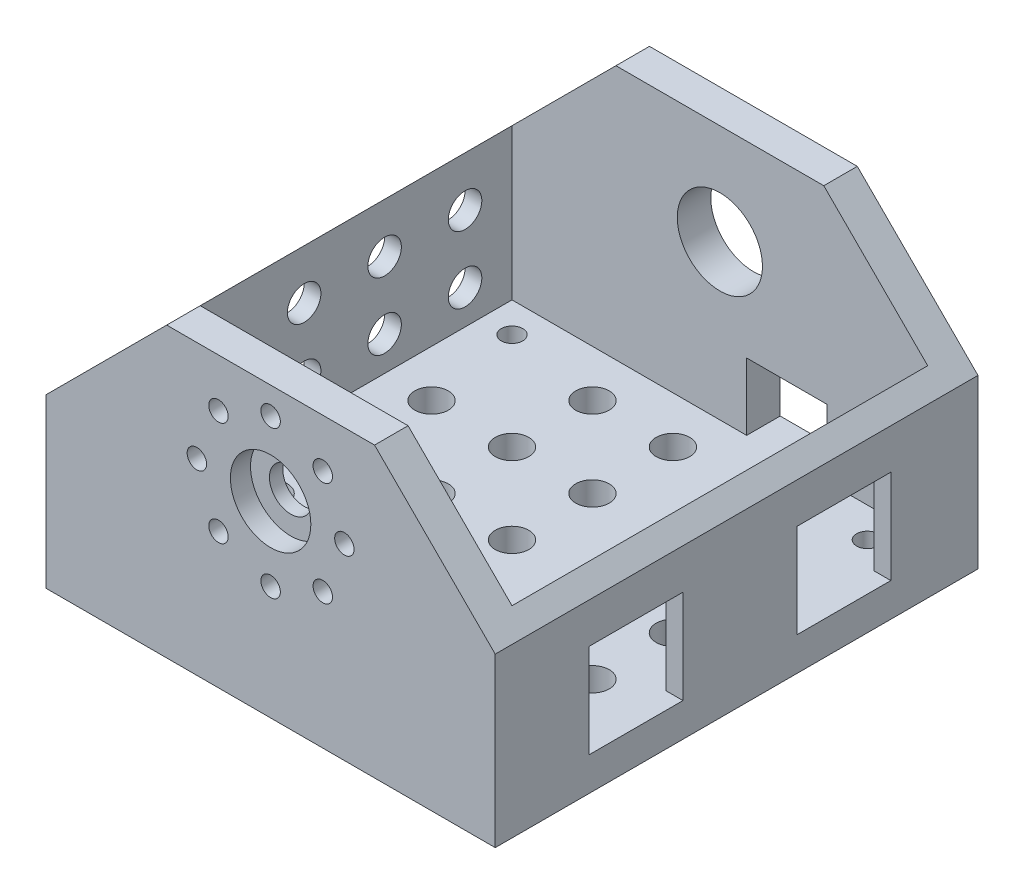
from build123d import *

# Parameters (mm, degrees)
SKETCH1_W             = 67
SKETCH1_H             = 72
BOSS_EXTRUDE1_DEPTH   = 43
CUT_EXTRUDE1_DEPTH    = 91.306422806
SKETCH3_W             = 62
SKETCH3_H             = 62
CUT_EXTRUDE2_DEPTH    = 38
CUT_EXTRUDE3_REACH    = 92.306
SKETCH4_R             = 6.35
SKETCH5_R             = 6
CUT_EXTRUDE4_DEPTH    = 3
CUT_EXTRUDE5_REACH    = 89.933
SKETCH6_R             = 3.175
CUT_EXTRUDE6_REACH    = 92.306
SKETCH7_R             = 1.45
CIRPATTERN1_COUNT     = 8
CUT_EXTRUDE7_REACH    = 89.373
SKETCH8_R             = 2.5
FRONT_VENT_COUNT      = 5
FRONT_VENT_PITCH      = 12
FRONT_VENT_COUNT_DIR2 = 2
FRONT_VENT_PITCH_DIR2 = 10
BOTTOM_VENT_REACH     = 64.147
SKETCH10_R            = 2.5
SKETCH12_R            = 1.6
MOUNTING_HOLES_DEPTH  = 63.147003146
CUT_EXTRUDE12_REACH   = 89.373
SKETCH13_W            = 14
SKETCH13_H            = 14
CUT_EXTRUDE13_REACH   = 92.306
SKETCH14_W            = 12
SKETCH14_H            = 10


with BuildPart() as part:
    # Sketch1 → Boss-Extrude1 (new body)
    with BuildSketch(Plane(origin=(0, 0, 0), x_dir=(1, 0, 0), z_dir=(0, 1, 0))):
        Rectangle(SKETCH1_W, SKETCH1_H)
    extrude(amount=BOSS_EXTRUDE1_DEPTH)

    # Sketch2 → Cut-Extrude1 (cut, through all)
    with BuildSketch(Plane.XY.offset(36)):
        Polygon((-33.5, 43), (-33.5, 25), (-15.5, 43), align=None)
        Polygon((33.5, 43), (33.5, 25), (15.5, 43), align=None)
    extrude(amount=-CUT_EXTRUDE1_DEPTH, mode=Mode.SUBTRACT)

    # Sketch3 → Cut-Extrude2 (cut)
    with BuildSketch(Plane(origin=(0, 43, 0), x_dir=(1, 0, 0), z_dir=(0, 1, 0))):
        Rectangle(SKETCH3_W, SKETCH3_H)
    extrude(amount=-CUT_EXTRUDE2_DEPTH, mode=Mode.SUBTRACT)

    # Sketch4 → Cut-Extrude3 (cut, up to next)
    with BuildSketch(Plane(origin=(0, 0, -36), x_dir=(-1, 0, 0), z_dir=(0, 0, -1)), mode=Mode.PRIVATE) as cut_extrude3_sk1:
        with Locations((0, 28)):
            Circle(SKETCH4_R)
    cut_extrude3_tool1 = extrude(cut_extrude3_sk1.sketch, amount=-CUT_EXTRUDE3_REACH, mode=Mode.PRIVATE) & part.part
    add(cut_extrude3_tool1.solids().sort_by_distance((0, 28, -36))[0], mode=Mode.SUBTRACT)

    # Sketch5 → Cut-Extrude4 (cut)
    with BuildSketch(Plane.XY.offset(36)):
        with Locations((0, 28)):
            Circle(SKETCH5_R)
    extrude(amount=-CUT_EXTRUDE4_DEPTH, mode=Mode.SUBTRACT)

    # Sketch6 → Cut-Extrude5 (cut, up to next)
    with BuildSketch(Plane.XY.offset(33), mode=Mode.PRIVATE) as cut_extrude5_sk1:
        with Locations((0, 28)):
            Circle(SKETCH6_R)
    cut_extrude5_tool1 = extrude(cut_extrude5_sk1.sketch, amount=-CUT_EXTRUDE5_REACH, mode=Mode.PRIVATE) & part.part
    add(cut_extrude5_tool1.solids().sort_by_distance((0, 28, 33))[0], mode=Mode.SUBTRACT)

    # Sketch7 → Cut-Extrude6 (cut, up to next)
    with BuildSketch(Plane.XY.offset(36), mode=Mode.PRIVATE) as cut_extrude6_sk1:
        with Locations((0, 39)):
            Circle(SKETCH7_R)
    cut_extrude6_tool1 = extrude(cut_extrude6_sk1.sketch, amount=-CUT_EXTRUDE6_REACH, mode=Mode.PRIVATE) & part.part
    cut_extrude6 = cut_extrude6_tool1.solids().sort_by_distance((0, 39, 36))[0]
    add(cut_extrude6, mode=Mode.SUBTRACT)

    # CirPattern1: Cut-Extrude6 ×8 about axis
    cirpattern1_axis = Axis((0, 28, 33), (0, 0, 1))
    for i in range(1, CIRPATTERN1_COUNT):
        add(cut_extrude6.rotate(cirpattern1_axis, i * 360 / CIRPATTERN1_COUNT), mode=Mode.SUBTRACT)

    # Sketch8 → Cut-Extrude7 (cut, up to next)
    with BuildSketch(Plane.ZY.offset(33.5), mode=Mode.PRIVATE) as cut_extrude7_sk1:
        with Locations((-24, 20.1)):
            Circle(SKETCH8_R)
    cut_extrude7_tool1 = extrude(cut_extrude7_sk1.sketch, amount=-CUT_EXTRUDE7_REACH, mode=Mode.PRIVATE) & part.part
    cut_extrude7 = cut_extrude7_tool1.solids().sort_by_distance((-33.5, 20.1, -24))[0]
    add(cut_extrude7, mode=Mode.SUBTRACT)

    # Front Vent: Cut-Extrude7 5 × 2
    with Locations(*[(0, -j * FRONT_VENT_PITCH_DIR2, i * FRONT_VENT_PITCH) for i in range(FRONT_VENT_COUNT) for j in range(FRONT_VENT_COUNT_DIR2) if (i, j) != (0, 0)]):
        add(cut_extrude7, mode=Mode.SUBTRACT)

    # Sketch10 → Bottom Vent (cut, up to next)
    with BuildSketch(Plane(origin=(0, 5, 0), x_dir=(1, 0, 0), z_dir=(0, 1, 0)), mode=Mode.PRIVATE) as bottom_vent_sk1:
        with Locations((-12, 24)):
            Circle(SKETCH10_R)
    bottom_vent_tool1 = extrude(bottom_vent_sk1.sketch, amount=-BOTTOM_VENT_REACH, mode=Mode.PRIVATE) & part.part
    # Sketch10 → Bottom Vent (cut, up to next)
    with BuildSketch(Plane(origin=(0, 5, 0), x_dir=(1, 0, 0), z_dir=(0, 1, 0)), mode=Mode.PRIVATE) as bottom_vent_sk2:
        with Locations((0, 24)):
            Circle(SKETCH10_R)
    bottom_vent_tool2 = extrude(bottom_vent_sk2.sketch, amount=-BOTTOM_VENT_REACH, mode=Mode.PRIVATE) & part.part
    # Sketch10 → Bottom Vent (cut, up to next)
    with BuildSketch(Plane(origin=(0, 5, 0), x_dir=(1, 0, 0), z_dir=(0, 1, 0)), mode=Mode.PRIVATE) as bottom_vent_sk3:
        with Locations((12, 24)):
            Circle(SKETCH10_R)
    bottom_vent_tool3 = extrude(bottom_vent_sk3.sketch, amount=-BOTTOM_VENT_REACH, mode=Mode.PRIVATE) & part.part
    # Sketch10 → Bottom Vent (cut, up to next)
    with BuildSketch(Plane(origin=(0, 5, 0), x_dir=(1, 0, 0), z_dir=(0, 1, 0)), mode=Mode.PRIVATE) as bottom_vent_sk4:
        with Locations((-12, 12)):
            Circle(SKETCH10_R)
    bottom_vent_tool4 = extrude(bottom_vent_sk4.sketch, amount=-BOTTOM_VENT_REACH, mode=Mode.PRIVATE) & part.part
    # Sketch10 → Bottom Vent (cut, up to next)
    with BuildSketch(Plane(origin=(0, 5, 0), x_dir=(1, 0, 0), z_dir=(0, 1, 0)), mode=Mode.PRIVATE) as bottom_vent_sk5:
        with Locations((0, 12)):
            Circle(SKETCH10_R)
    bottom_vent_tool5 = extrude(bottom_vent_sk5.sketch, amount=-BOTTOM_VENT_REACH, mode=Mode.PRIVATE) & part.part
    # Sketch10 → Bottom Vent (cut, up to next)
    with BuildSketch(Plane(origin=(0, 5, 0), x_dir=(1, 0, 0), z_dir=(0, 1, 0)), mode=Mode.PRIVATE) as bottom_vent_sk6:
        with Locations((12, 12)):
            Circle(SKETCH10_R)
    bottom_vent_tool6 = extrude(bottom_vent_sk6.sketch, amount=-BOTTOM_VENT_REACH, mode=Mode.PRIVATE) & part.part
    # Sketch10 → Bottom Vent (cut, up to next)
    with BuildSketch(Plane(origin=(0, 5, 0), x_dir=(1, 0, 0), z_dir=(0, 1, 0)), mode=Mode.PRIVATE) as bottom_vent_sk7:
        with Locations((24, 12)):
            Circle(SKETCH10_R)
    bottom_vent_tool7 = extrude(bottom_vent_sk7.sketch, amount=-BOTTOM_VENT_REACH, mode=Mode.PRIVATE) & part.part
    # Sketch10 → Bottom Vent (cut, up to next)
    with BuildSketch(Plane(origin=(0, 5, 0), x_dir=(1, 0, 0), z_dir=(0, 1, 0)), mode=Mode.PRIVATE) as bottom_vent_sk8:
        with Locations((-12, 0)):
            Circle(SKETCH10_R)
    bottom_vent_tool8 = extrude(bottom_vent_sk8.sketch, amount=-BOTTOM_VENT_REACH, mode=Mode.PRIVATE) & part.part
    # Sketch10 → Bottom Vent (cut, up to next)
    with BuildSketch(Plane(origin=(0, 5, 0), x_dir=(1, 0, 0), z_dir=(0, 1, 0)), mode=Mode.PRIVATE) as bottom_vent_sk9:
        Circle(SKETCH10_R)
    bottom_vent_tool9 = extrude(bottom_vent_sk9.sketch, amount=-BOTTOM_VENT_REACH, mode=Mode.PRIVATE) & part.part
    # Sketch10 → Bottom Vent (cut, up to next)
    with BuildSketch(Plane(origin=(0, 5, 0), x_dir=(1, 0, 0), z_dir=(0, 1, 0)), mode=Mode.PRIVATE) as bottom_vent_sk10:
        with Locations((12, 0)):
            Circle(SKETCH10_R)
    bottom_vent_tool10 = extrude(bottom_vent_sk10.sketch, amount=-BOTTOM_VENT_REACH, mode=Mode.PRIVATE) & part.part
    # Sketch10 → Bottom Vent (cut, up to next)
    with BuildSketch(Plane(origin=(0, 5, 0), x_dir=(1, 0, 0), z_dir=(0, 1, 0)), mode=Mode.PRIVATE) as bottom_vent_sk11:
        with Locations((24, 0)):
            Circle(SKETCH10_R)
    bottom_vent_tool11 = extrude(bottom_vent_sk11.sketch, amount=-BOTTOM_VENT_REACH, mode=Mode.PRIVATE) & part.part
    # Sketch10 → Bottom Vent (cut, up to next)
    with BuildSketch(Plane(origin=(0, 5, 0), x_dir=(1, 0, 0), z_dir=(0, 1, 0)), mode=Mode.PRIVATE) as bottom_vent_sk12:
        with Locations((-12, -12)):
            Circle(SKETCH10_R)
    bottom_vent_tool12 = extrude(bottom_vent_sk12.sketch, amount=-BOTTOM_VENT_REACH, mode=Mode.PRIVATE) & part.part
    # Sketch10 → Bottom Vent (cut, up to next)
    with BuildSketch(Plane(origin=(0, 5, 0), x_dir=(1, 0, 0), z_dir=(0, 1, 0)), mode=Mode.PRIVATE) as bottom_vent_sk13:
        with Locations((0, -12)):
            Circle(SKETCH10_R)
    bottom_vent_tool13 = extrude(bottom_vent_sk13.sketch, amount=-BOTTOM_VENT_REACH, mode=Mode.PRIVATE) & part.part
    # Sketch10 → Bottom Vent (cut, up to next)
    with BuildSketch(Plane(origin=(0, 5, 0), x_dir=(1, 0, 0), z_dir=(0, 1, 0)), mode=Mode.PRIVATE) as bottom_vent_sk14:
        with Locations((12, -12)):
            Circle(SKETCH10_R)
    bottom_vent_tool14 = extrude(bottom_vent_sk14.sketch, amount=-BOTTOM_VENT_REACH, mode=Mode.PRIVATE) & part.part
    # Sketch10 → Bottom Vent (cut, up to next)
    with BuildSketch(Plane(origin=(0, 5, 0), x_dir=(1, 0, 0), z_dir=(0, 1, 0)), mode=Mode.PRIVATE) as bottom_vent_sk15:
        with Locations((24, -12)):
            Circle(SKETCH10_R)
    bottom_vent_tool15 = extrude(bottom_vent_sk15.sketch, amount=-BOTTOM_VENT_REACH, mode=Mode.PRIVATE) & part.part
    # Sketch10 → Bottom Vent (cut, up to next)
    with BuildSketch(Plane(origin=(0, 5, 0), x_dir=(1, 0, 0), z_dir=(0, 1, 0)), mode=Mode.PRIVATE) as bottom_vent_sk16:
        with Locations((-12, -24)):
            Circle(SKETCH10_R)
    bottom_vent_tool16 = extrude(bottom_vent_sk16.sketch, amount=-BOTTOM_VENT_REACH, mode=Mode.PRIVATE) & part.part
    # Sketch10 → Bottom Vent (cut, up to next)
    with BuildSketch(Plane(origin=(0, 5, 0), x_dir=(1, 0, 0), z_dir=(0, 1, 0)), mode=Mode.PRIVATE) as bottom_vent_sk17:
        with Locations((0, -24)):
            Circle(SKETCH10_R)
    bottom_vent_tool17 = extrude(bottom_vent_sk17.sketch, amount=-BOTTOM_VENT_REACH, mode=Mode.PRIVATE) & part.part
    # Sketch10 → Bottom Vent (cut, up to next)
    with BuildSketch(Plane(origin=(0, 5, 0), x_dir=(1, 0, 0), z_dir=(0, 1, 0)), mode=Mode.PRIVATE) as bottom_vent_sk18:
        with Locations((12, -24)):
            Circle(SKETCH10_R)
    bottom_vent_tool18 = extrude(bottom_vent_sk18.sketch, amount=-BOTTOM_VENT_REACH, mode=Mode.PRIVATE) & part.part
    # Sketch10 → Bottom Vent (cut, up to next)
    with BuildSketch(Plane(origin=(0, 5, 0), x_dir=(1, 0, 0), z_dir=(0, 1, 0)), mode=Mode.PRIVATE) as bottom_vent_sk19:
        with Locations((-24, 12)):
            Circle(SKETCH10_R)
    bottom_vent_tool19 = extrude(bottom_vent_sk19.sketch, amount=-BOTTOM_VENT_REACH, mode=Mode.PRIVATE) & part.part
    # Sketch10 → Bottom Vent (cut, up to next)
    with BuildSketch(Plane(origin=(0, 5, 0), x_dir=(1, 0, 0), z_dir=(0, 1, 0)), mode=Mode.PRIVATE) as bottom_vent_sk20:
        with Locations((-24, 0)):
            Circle(SKETCH10_R)
    bottom_vent_tool20 = extrude(bottom_vent_sk20.sketch, amount=-BOTTOM_VENT_REACH, mode=Mode.PRIVATE) & part.part
    # Sketch10 → Bottom Vent (cut, up to next)
    with BuildSketch(Plane(origin=(0, 5, 0), x_dir=(1, 0, 0), z_dir=(0, 1, 0)), mode=Mode.PRIVATE) as bottom_vent_sk21:
        with Locations((-24, -12)):
            Circle(SKETCH10_R)
    bottom_vent_tool21 = extrude(bottom_vent_sk21.sketch, amount=-BOTTOM_VENT_REACH, mode=Mode.PRIVATE) & part.part
    add(bottom_vent_tool1.solids().sort_by_distance((-12, 5, -24))[0], mode=Mode.SUBTRACT)
    add(bottom_vent_tool2.solids().sort_by_distance((0, 5, -24))[0], mode=Mode.SUBTRACT)
    add(bottom_vent_tool3.solids().sort_by_distance((12, 5, -24))[0], mode=Mode.SUBTRACT)
    add(bottom_vent_tool4.solids().sort_by_distance((-12, 5, -12))[0], mode=Mode.SUBTRACT)
    add(bottom_vent_tool5.solids().sort_by_distance((0, 5, -12))[0], mode=Mode.SUBTRACT)
    add(bottom_vent_tool6.solids().sort_by_distance((12, 5, -12))[0], mode=Mode.SUBTRACT)
    add(bottom_vent_tool7.solids().sort_by_distance((24, 5, -12))[0], mode=Mode.SUBTRACT)
    add(bottom_vent_tool8.solids().sort_by_distance((-12, 5, 0))[0], mode=Mode.SUBTRACT)
    add(bottom_vent_tool9.solids().sort_by_distance((0, 5, 0))[0], mode=Mode.SUBTRACT)
    add(bottom_vent_tool10.solids().sort_by_distance((12, 5, 0))[0], mode=Mode.SUBTRACT)
    add(bottom_vent_tool11.solids().sort_by_distance((24, 5, 0))[0], mode=Mode.SUBTRACT)
    add(bottom_vent_tool12.solids().sort_by_distance((-12, 5, 12))[0], mode=Mode.SUBTRACT)
    add(bottom_vent_tool13.solids().sort_by_distance((0, 5, 12))[0], mode=Mode.SUBTRACT)
    add(bottom_vent_tool14.solids().sort_by_distance((12, 5, 12))[0], mode=Mode.SUBTRACT)
    add(bottom_vent_tool15.solids().sort_by_distance((24, 5, 12))[0], mode=Mode.SUBTRACT)
    add(bottom_vent_tool16.solids().sort_by_distance((-12, 5, 24))[0], mode=Mode.SUBTRACT)
    add(bottom_vent_tool17.solids().sort_by_distance((0, 5, 24))[0], mode=Mode.SUBTRACT)
    add(bottom_vent_tool18.solids().sort_by_distance((12, 5, 24))[0], mode=Mode.SUBTRACT)
    add(bottom_vent_tool19.solids().sort_by_distance((-24, 5, -12))[0], mode=Mode.SUBTRACT)
    add(bottom_vent_tool20.solids().sort_by_distance((-24, 5, 0))[0], mode=Mode.SUBTRACT)
    add(bottom_vent_tool21.solids().sort_by_distance((-24, 5, 12))[0], mode=Mode.SUBTRACT)

    # Sketch12 → Mounting Holes (cut, through all)
    with BuildSketch(Plane(origin=(0, 5, 0), x_dir=(1, 0, 0), z_dir=(0, 1, 0))):
        with Locations((-26.5, 26.5)):
            Circle(SKETCH12_R)
        with Locations((26.5, 26.5)):
            Circle(SKETCH12_R)
        with Locations((-26.5, -26.5)):
            Circle(SKETCH12_R)
        with Locations((26.5, -26.5)):
            Circle(SKETCH12_R)
    extrude(amount=-MOUNTING_HOLES_DEPTH, mode=Mode.SUBTRACT)

    # Sketch13 → Cut-Extrude12 (cut, up to next)
    with BuildSketch(Plane(origin=(33.5, 0, 0), x_dir=(0, 0, -1), z_dir=(1, 0, 0)), mode=Mode.PRIVATE) as cut_extrude12_sk1:
        with Locations((-15, 12)):
            Rectangle(SKETCH13_W, SKETCH13_H)
    cut_extrude12_tool1 = extrude(cut_extrude12_sk1.sketch, amount=-CUT_EXTRUDE12_REACH, mode=Mode.PRIVATE) & part.part
    # Sketch13 → Cut-Extrude12 (cut, up to next)
    with BuildSketch(Plane(origin=(33.5, 0, 0), x_dir=(0, 0, -1), z_dir=(1, 0, 0)), mode=Mode.PRIVATE) as cut_extrude12_sk2:
        with Locations((16, 12)):
            Rectangle(SKETCH13_W, SKETCH13_H)
    cut_extrude12_tool2 = extrude(cut_extrude12_sk2.sketch, amount=-CUT_EXTRUDE12_REACH, mode=Mode.PRIVATE) & part.part
    add(cut_extrude12_tool1.solids().sort_by_distance((33.5, 12, 15))[0], mode=Mode.SUBTRACT)
    add(cut_extrude12_tool2.solids().sort_by_distance((33.5, 12, -16))[0], mode=Mode.SUBTRACT)

    # Sketch14 → Cut-Extrude13 (cut, up to next)
    with BuildSketch(Plane(origin=(0, 0, -36), x_dir=(-1, 0, 0), z_dir=(0, 0, -1)), mode=Mode.PRIVATE) as cut_extrude13_sk1:
        with Locations((-10, 10)):
            Rectangle(SKETCH14_W, SKETCH14_H)
    cut_extrude13_tool1 = extrude(cut_extrude13_sk1.sketch, amount=-CUT_EXTRUDE13_REACH, mode=Mode.PRIVATE) & part.part
    add(cut_extrude13_tool1.solids().sort_by_distance((10, 10, -36))[0], mode=Mode.SUBTRACT)


solid = part.part
